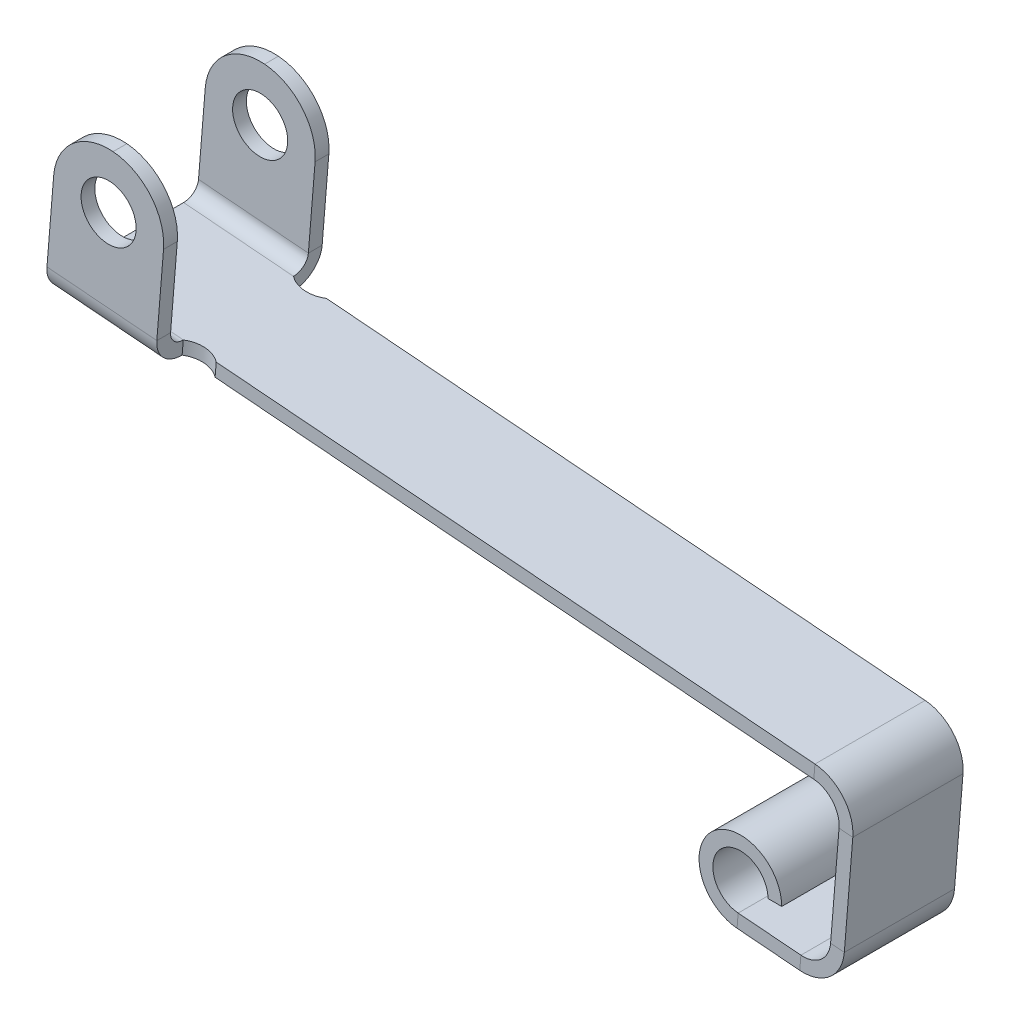
from build123d import *

# Parameters (mm, degrees)
ODGI_CIE_BAZOWE1_DEPTH      = 1.75
ODGI_CIE_BAZOWE1_DEPTH_BACK = 2.25
WYTNIJ_WYCI_GNI_CIE1_REACH  = 28.618
ODGI_CIE_KRAW_DZI1_DEPTH    = 4
ODGI_CIE_KRAW_DZI2_DEPTH    = 4
SZKIC13_R                   = 1
WYTNIJ_WYCI_GNI_CIE2_DEPTH  = 32.329703674
ZAOKR_GLENIE1_R             = 2


# Sheet-metal steps are written as plain solids
with BuildPart() as part:
    # Szkic1 → Odgięcie bazowe1 (new, two sides: drawn at the far end of the back side and taken through both)
    with BuildSketch(Plane.XY.offset(-ODGI_CIE_BAZOWE1_DEPTH_BACK)):
        with BuildLine():
            Line((-24.746406247, 12.272623445), (2.164511805, 10.081165123))
            ThreePointArc((2.164511805, 10.081165123), (2.845512893, 9.731845847), (3.080047351, 9.003299331))
            Line((3.080047351, 9.003299331), (2.773055226, 5.233462675))
            ThreePointArc((2.773055226, 5.233462675), (2.42373595, 4.552461587), (1.695189434, 4.317927129))
            Line((1.695189434, 4.317927129), (-0.581165123, 4.503299331))
            ThreePointArc((-0.581165123, 4.503299331), (-1.177803392, 6.235243199), (0.5, 5.5))
            Line((0.5, 5.5), (1, 5.5))
            ThreePointArc((1, 5.5), (-1.516705088, 6.602864798), (-0.621747685, 4.004948997))
            Line((-0.621747685, 4.004948997), (1.654606873, 3.819576795))
            ThreePointArc((1.654606873, 3.819576795), (2.747426646, 4.171378482), (3.27140556, 5.192880113))
            Line((3.27140556, 5.192880113), (3.578397685, 8.96271677))
            ThreePointArc((3.578397685, 8.96271677), (3.226595998, 10.055536543), (2.205094367, 10.579515457))
            Line((2.205094367, 10.579515457), (-24.705823686, 12.77097378))
            Line((-24.705823686, 12.77097378), (-24.746406247, 12.272623445))
        make_face()
    extrude(amount=ODGI_CIE_BAZOWE1_DEPTH + ODGI_CIE_BAZOWE1_DEPTH_BACK)

    # Szkic6 → Wytnij-wyciągnięcie1 (cut, up to next)
    with BuildSketch(Plane(origin=(0.870381249, 10.688206219, 0), x_dir=(0.9967006686068912, -0.08116512304294364, 0), z_dir=(0.08116512304294363, 0.9967006686068911, 0)), mode=Mode.PRIVATE) as wytnij_wyci_gni_cie1_sk1:
        with BuildLine():
            Line((-20.460868644, -1.75), (-21.660868644, -1.75))
            ThreePointArc((-21.660868644, -1.75), (-21.060868644, -1.55), (-20.460868644, -1.75))
        make_face()
    wytnij_wyci_gni_cie1_tool1 = extrude(wytnij_wyci_gni_cie1_sk1.sketch, amount=-WYTNIJ_WYCI_GNI_CIE1_REACH, mode=Mode.PRIVATE) & part.part
    # Szkic6 → Wytnij-wyciągnięcie1 (cut, up to next)
    with BuildSketch(Plane(origin=(0.870381249, 10.688206219, 0), x_dir=(0.9967006686068912, -0.08116512304294364, 0), z_dir=(0.08116512304294363, 0.9967006686068911, 0)), mode=Mode.PRIVATE) as wytnij_wyci_gni_cie1_sk2:
        with BuildLine():
            Line((-20.460868644, 2.25), (-21.660868644, 2.25))
            ThreePointArc((-21.660868644, 2.25), (-21.060868644, 2.05), (-20.460868644, 2.25))
        make_face()
    wytnij_wyci_gni_cie1_tool2 = extrude(wytnij_wyci_gni_cie1_sk2.sketch, amount=-WYTNIJ_WYCI_GNI_CIE1_REACH, mode=Mode.PRIVATE) & part.part
    add(wytnij_wyci_gni_cie1_tool1.solids().sort_by_distance((-20.121001, 12.397614, 1.669272))[0], mode=Mode.SUBTRACT)
    add(wytnij_wyci_gni_cie1_tool2.solids().sort_by_distance((-20.121001, 12.397614, -2.169272))[0], mode=Mode.SUBTRACT)

    # Odgięcie krawędzi1 section (across the edge) → Odgięcie krawędzi1 (add)
    with BuildSketch(Plane(origin=(-24.705823686, 12.77097378, 2.25), x_dir=(0, 0, -1), z_dir=(0.9967006686068913, -0.08116512304294192, 0))):
        with BuildLine():
            Line((-0.5, 0.5), (-0.5, 5.5))
            Line((-0.5, 5.5), (0, 5.5))
            Line((0, 5.5), (0, 0.5))
            ThreePointArc((0, 0.5), (0.146446609, 0.146446609), (0.5, 0))
            Line((0.5, 0), (0.5, -0.5))
            ThreePointArc((0.5, -0.5), (-0.207106781, -0.207106781), (-0.5, 0.5))
        make_face()
    extrude(amount=ODGI_CIE_KRAW_DZI1_DEPTH)

    # Odgięcie krawędzi2 section (across the edge) → Odgięcie krawędzi2 (add)
    with BuildSketch(Plane(origin=(-20.719021011, 12.446313287, -2.75), x_dir=(0, 0, 1), z_dir=(-0.9967006686068913, 0.08116512304294192, 0))):
        with BuildLine():
            Line((-0.5, 0.5), (-0.5, 5.5))
            Line((-0.5, 5.5), (0, 5.5))
            Line((0, 5.5), (0, 0.5))
            ThreePointArc((0, 0.5), (0.146446609, 0.146446609), (0.5, 0))
            Line((0.5, 0), (0.5, -0.5))
            ThreePointArc((0.5, -0.5), (-0.207106781, -0.207106781), (-0.5, 0.5))
        make_face()
    extrude(amount=ODGI_CIE_KRAW_DZI2_DEPTH)

    # Szkic13 → Wytnij-wyciągnięcie2 (cut, through all)
    with BuildSketch(Plane.XY.offset(2.75)):
        with Locations((-22.428344418, 16.097095874)):
            Circle(SZKIC13_R)
    extrude(amount=-WYTNIJ_WYCI_GNI_CIE2_DEPTH, mode=Mode.SUBTRACT)

    # Zaokrąglenie1
    zaokr_glenie1_edges = [part.edges().sort_by_distance(p)[0] for p in [
        (-24.259415509, 18.252827457, -3),
        (-20.272612835, 17.928166965, -3),
        (-20.272612835, 17.928166965, 2.5),
        (-24.259415509, 18.252827457, 2.5),
    ]]
    fillet(zaokr_glenie1_edges, radius=ZAOKR_GLENIE1_R - 0.0001)  # a hair under: the kernel refuses the full size


solid = part.part
